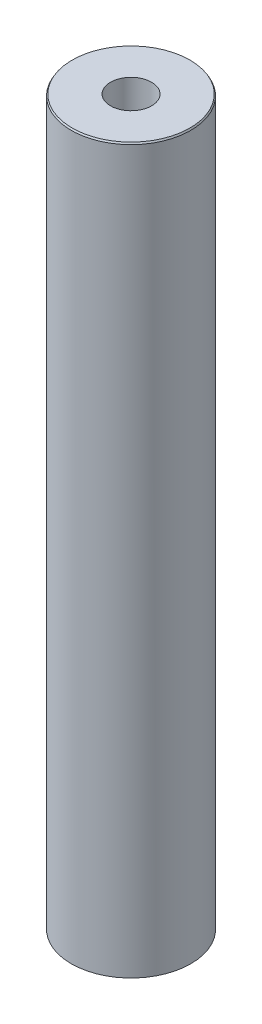
from build123d import *
from OCP.BRepFilletAPI import BRepFilletAPI_MakeChamfer

# Parameters (mm, degrees)
SKETCH1_R           = 32.5
BOSS_EXTRUDE1_DEPTH = 393.607728413
SKETCH2_R           = 11.147691658
CUT_EXTRUDE1_DEPTH  = 397.282151839
CHAMFER1_SIZE       = 0.856458868
CHAMFER1_SIZE2      = 0.494476758


with BuildPart() as part:
    # Sketch1 → Boss-Extrude1 (new body)
    with BuildSketch(Plane(origin=(0, 0, 0), x_dir=(1, 0, 0), z_dir=(0, 1, 0))):
        Circle(SKETCH1_R)
    extrude(amount=BOSS_EXTRUDE1_DEPTH)

    # Sketch2 → Cut-Extrude1 (cut, through all)
    with BuildSketch(Plane(origin=(0, 0, 0), x_dir=(1, 0, 0), z_dir=(0, 1, 0))):
        Circle(SKETCH2_R)
    extrude(amount=CUT_EXTRUDE1_DEPTH, mode=Mode.SUBTRACT)

    # Chamfer1: one chamfer whose edges measure the first distance from different faces: ONE call of the kernel's chamfer builder (chamfer() names one face for all edges)
    chamfer1_edges_1 = [part.edges().sort_by_distance(p)[0] for p in [
        (-32.5, 393.607728413, 0),
    ]]
    chamfer1_side_1 = [part.faces().sort_by_distance(p)[0] for p in [
        (-32.5, 196.803864206, 0),
    ]]
    chamfer1_edges_2 = [part.edges().sort_by_distance(p)[0] for p in [
        (-32.5, 0, 0),
    ]]
    chamfer1_side_2 = [part.faces().sort_by_distance(p)[0] for p in [
        (-31.580761184, 0, 0),
    ]]
    chamfer1 = BRepFilletAPI_MakeChamfer(part.part.solid().wrapped)
    for e in chamfer1_edges_1:
        chamfer1.Add(CHAMFER1_SIZE, CHAMFER1_SIZE2, e.wrapped, chamfer1_side_1[0].wrapped)  # the first distance lies on this face
    for e in chamfer1_edges_2:
        chamfer1.Add(CHAMFER1_SIZE, CHAMFER1_SIZE2, e.wrapped, chamfer1_side_2[0].wrapped)  # the first distance lies on this face
    add(Compound.cast(chamfer1.Shape()), mode=Mode.REPLACE)


solid = part.part
